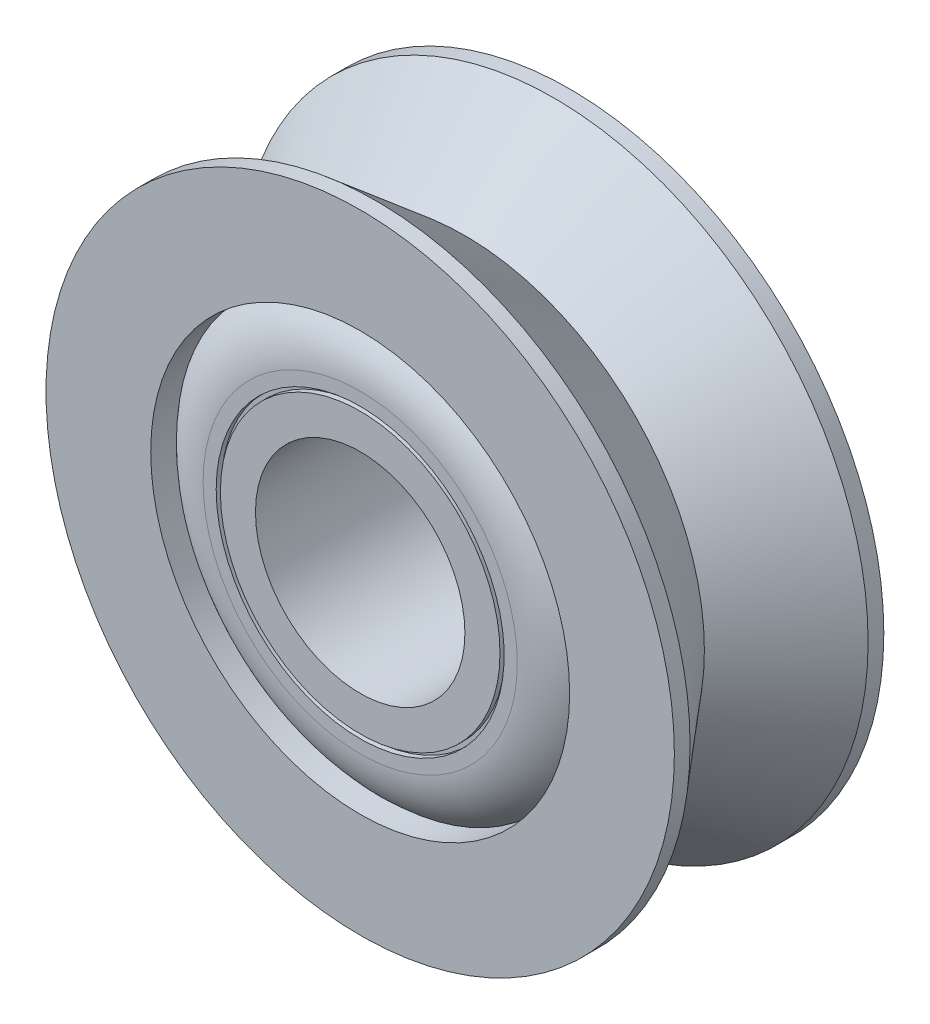
from build123d import *

# Parameters (mm, degrees)
SKETCH_3_R        = 6
EXTRUDE_1_DEPTH   = 4
OTHER_1_OUTLINE_R = 2
OTHER_1_DEPTH     = 4
SKETCH_14_W       = 0.1
SKETCH_14_H       = 0.08


# Read off the part's stored shape, not the designer's step: 孔1
with BuildPart() as part:
    # 草图3 → 凸台-拉伸1 (new body)
    with BuildSketch(Plane.XY):
        Circle(SKETCH_3_R)
    extrude(amount=EXTRUDE_1_DEPTH)

    # 孔1 outline → 孔1 (cut)
    with BuildSketch(Plane.XY):
        Circle(OTHER_1_OUTLINE_R)
    extrude(amount=OTHER_1_DEPTH, mode=Mode.SUBTRACT)

    # 草图11 → 切除-旋转1 (revolve, cut)
    with BuildSketch(Plane(origin=(0, 0, 0), x_dir=(0, 0, -1), z_dir=(1, 0, 0)), mode=Mode.PRIVATE) as cut_revolve_1_sk:
        Polygon((-0.3, 6), (-3.7, 6), (-2, 4.573530627), align=None)
    revolve(cut_revolve_1_sk.sketch.rotate(Axis((0, 0, 4.816901408), (0, 0, -1)), 90), axis=Axis((0, 0, 4.816901408), (0, 0, -1)), mode=Mode.SUBTRACT)

    # 草图12 → 切除-旋转2 (revolve, cut)
    with BuildSketch(Plane(origin=(0, 0, 0), x_dir=(0, 0, -1), z_dir=(1, 0, 0)), mode=Mode.PRIVATE) as cut_revolve_2_sk:
        with BuildLine():
            Line((0, 4), (-0.5, 4))
            ThreePointArc((-0.5, 4), (-0.139152669, 3.555423666), (0, 3))
            Line((0, 3), (0, 4))
        make_face()
    cut_revolve_2 = revolve(cut_revolve_2_sk.sketch.rotate(Axis((0, 0, 0), (0, 0, 1)), 90), axis=Axis((0, 0, 0), (0, 0, 1)), mode=Mode.SUBTRACT)

    # 镜向1: 切除-旋转2 across plane
    add(cut_revolve_2.mirror(Plane.XY.offset(2)), mode=Mode.SUBTRACT)

    # 草图14 → 切除-旋转3 (revolve, cut)
    with BuildSketch(Plane(origin=(0, 0, 0), x_dir=(0, 0, -1), z_dir=(1, 0, 0)), mode=Mode.PRIVATE) as cut_revolve_3_sk:
        with Locations((-0.05, 2.71)):
            Rectangle(SKETCH_14_W, SKETCH_14_H)
    cut_revolve_3 = revolve(cut_revolve_3_sk.sketch.rotate(Axis((0, 0, 0), (0, 0, 1)), 90), axis=Axis((0, 0, 0), (0, 0, 1)), mode=Mode.SUBTRACT)

    # 镜向2: 切除-旋转3 across plane
    add(cut_revolve_3.mirror(Plane.XY.offset(2)), mode=Mode.SUBTRACT)


solid = part.part
